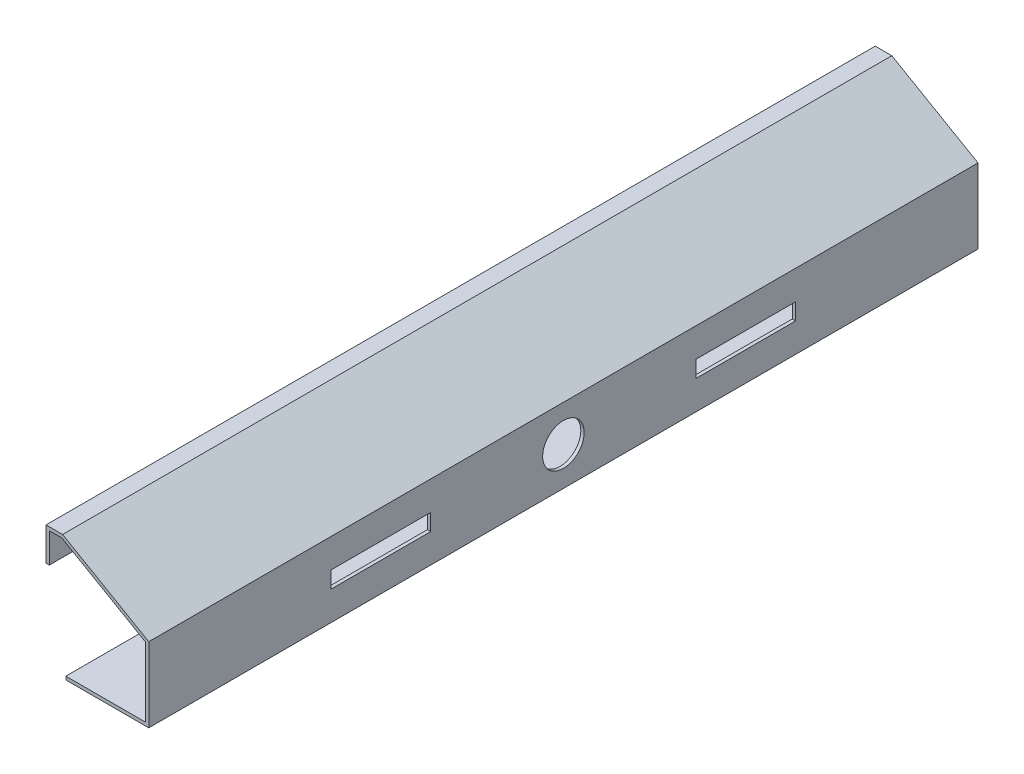
from build123d import *

# Parameters (mm, degrees)
BOSS_EXTRUDE1_DEPTH = 500
SKETCH2_R           = 12.5
CUT_EXTRUDE1_DEPTH  = 506.8302388
SKETCH3_W           = 60
SKETCH3_H           = 10
CUT_EXTRUDE2_DEPTH  = 2
SKETCH4_W           = 500
SKETCH4_H           = 20
BOSS_EXTRUDE2_DEPTH = 2


with BuildPart() as part:
    # Sketch1 → Boss-Extrude1 (new body)
    with BuildSketch(Plane.XY):
        Polygon((0, 0), (-51.961524227, 30), (-61.961524227, 30), (-61.961524227, 28), (-52.497422612, 28), (-2, -1.154700538), (-2, -43), (-50, -43), (-50, -45), (0, -45), align=None)
    extrude(amount=BOSS_EXTRUDE1_DEPTH)

    # Sketch2 → Cut-Extrude1 (cut, through all)
    with BuildSketch(Plane(origin=(0, 0, 0), x_dir=(0, 0, -1), z_dir=(1, 0, 0))):
        with Locations((-250, -22)):
            Circle(SKETCH2_R)
    extrude(amount=-CUT_EXTRUDE1_DEPTH, mode=Mode.SUBTRACT)

    # Sketch3 → Cut-Extrude2 (cut)
    with BuildSketch(Plane(origin=(0, 0, 0), x_dir=(0, 0, -1), z_dir=(1, 0, 0))):
        with Locations((-140, -22.5)):
            Rectangle(SKETCH3_W, SKETCH3_H)
        with Locations((-360, -22.5)):
            Rectangle(SKETCH3_W, SKETCH3_H)
    extrude(amount=-CUT_EXTRUDE2_DEPTH, mode=Mode.SUBTRACT)

    # Sketch4 → Boss-Extrude2 (add)
    with BuildSketch(Plane.ZY.offset(61.961524227)):
        with Locations((250, 20)):
            Rectangle(SKETCH4_W, SKETCH4_H)
    extrude(amount=-BOSS_EXTRUDE2_DEPTH)


solid = part.part
